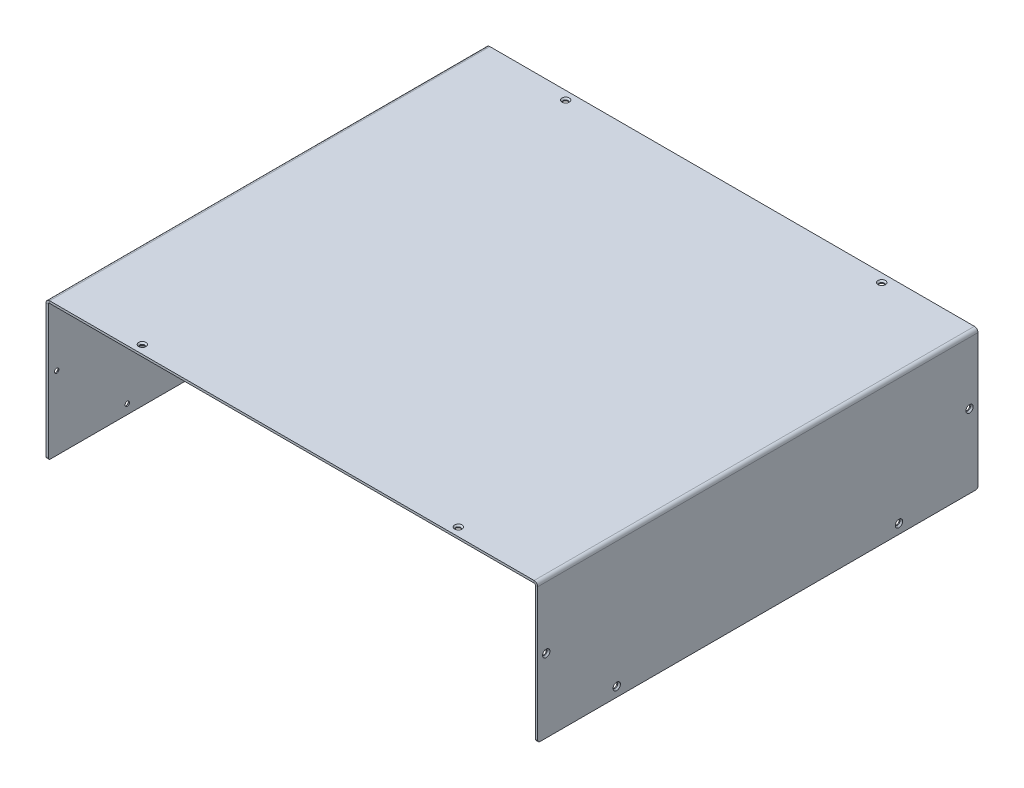
from build123d import *

# Parameters (mm, degrees)
FLANGE_BASE1_DEPTH                   = 390
ESBO_O6_R                            = 2
CORTE_EXTRUS_O1_DEPTH                = 558
ESBO_O7_R                            = 2
CORTE_EXTRUS_O2_DEPTH                = 558
QUEBRA_CANTO1_START                  = -2
QUEBRA_CANTO1_DEPTH                  = 435.6
ESCAREADO_PARA_SFHCS_M41_D           = 4
ESCAREADO_PARA_SFHCS_M41_CSINK_D     = 6.5
ESCAREADO_PARA_SFHCS_M41_CSINK_ANGLE = 90
ESCAREADO_PARA_SFHCS_M42_D           = 4
ESCAREADO_PARA_SFHCS_M42_CSINK_D     = 6.5
ESCAREADO_PARA_SFHCS_M42_CSINK_ANGLE = 90
ESCAREADO_PARA_SFHCS_M43_D           = 4
ESCAREADO_PARA_SFHCS_M43_CSINK_D     = 6.5
ESCAREADO_PARA_SFHCS_M43_CSINK_ANGLE = 90


# Read off the part's stored shape, not the designer's step: Quebra-Canto1
# Sheet-metal steps are written as plain solids
with BuildPart() as part:
    # Esboço1 → Flange-base1 (new body)
    with BuildSketch(Plane.XY):
        with BuildLine():
            Line((0, 0), (0, 119.8))
            ThreePointArc((0, 119.8), (0.351471863, 120.648528137), (1.2, 121))
            Line((1.2, 121), (430.4, 121))
            ThreePointArc((430.4, 121), (431.248528137, 120.648528137), (431.6, 119.8))
            Line((431.6, 119.8), (431.6, 0))
            Line((431.6, 0), (433.6, 0))
            Line((433.6, 0), (433.6, 119.8))
            ThreePointArc((433.6, 119.8), (432.6627417, 122.0627417), (430.4, 123))
            Line((430.4, 123), (1.2, 123))
            ThreePointArc((1.2, 123), (-1.0627417, 122.0627417), (-2, 119.8))
            Line((-2, 119.8), (-2, 0))
            Line((-2, 0), (0, 0))
        make_face()
    extrude(amount=FLANGE_BASE1_DEPTH)

    # Esboço6 → Corte-extrusão1 (cut)
    with BuildSketch(Plane(origin=(433.6, 0, 0), x_dir=(0, 0, -1), z_dir=(1, 0, 0))):
        with Locations(Location((-382.5, 65, 0), (0, 0, 180))):
            Circle(ESBO_O6_R)
        with Locations(Location((-320, 8.4, 0), (0, 0, 180))):
            Circle(ESBO_O6_R)
        with Locations(Location((-70, 8.4, 0), (0, 0, 180))):
            Circle(ESBO_O6_R)
        with Locations(Location((-7.5, 65, 0), (0, 0, 180))):
            Circle(ESBO_O6_R)
    extrude(amount=-CORTE_EXTRUS_O1_DEPTH, mode=Mode.SUBTRACT)

    # Esboço7 → Corte-extrusão2 (cut)
    with BuildSketch(Plane(origin=(0, 123, 0), x_dir=(1, 0, 0), z_dir=(0, 1, 0))):
        with Locations(Location((75.8, -7.5, 0), (0, 0, 270))):
            Circle(ESBO_O7_R)
        with Locations(Location((355.8, -7.5, 0), (0, 0, 270))):
            Circle(ESBO_O7_R)
        with Locations(Location((355.8, -382.5, 0), (0, 0, 270))):
            Circle(ESBO_O7_R)
        with Locations(Location((75.8, -382.5, 0), (0, 0, 270))):
            Circle(ESBO_O7_R)
    extrude(amount=-CORTE_EXTRUS_O2_DEPTH, mode=Mode.SUBTRACT)

    # Quebra-Canto1 outline → Quebra-Canto1 (cut)
    with BuildSketch(Plane.YZ.offset(QUEBRA_CANTO1_START)):
        with BuildLine():
            Line((0, 390), (0, 388))
            ThreePointArc((0, 388), (0.585786438, 389.414213562), (2, 390))
            Line((2, 390), (0, 390))
        make_face()
        with BuildLine():
            ThreePointArc((2, 0), (0.585786438, 0.585786438), (0, 2))
            Line((0, 2), (0, 0))
            Line((0, 0), (2, 0))
        make_face()
    extrude(amount=QUEBRA_CANTO1_DEPTH, mode=Mode.SUBTRACT)

    # Escareado para SFHCS M41 (through all)
    with Locations(Plane(origin=(0, 123, 0), x_dir=(1, 0, 0), z_dir=(0, 1, 0))):
        with Locations((75.8, -382.5), (355.8, -382.5), (355.8, -7.5), (75.8, -7.5)):
            CounterSinkHole(ESCAREADO_PARA_SFHCS_M41_D / 2, ESCAREADO_PARA_SFHCS_M41_CSINK_D / 2, counter_sink_angle=ESCAREADO_PARA_SFHCS_M41_CSINK_ANGLE)

    # Escareado para SFHCS M42 (through all)
    with Locations(Plane.ZY.offset(2)):
        with Locations((382.5, 65), (320, 8.4), (7.5, 65), (70, 8.4)):
            CounterSinkHole(ESCAREADO_PARA_SFHCS_M42_D / 2, ESCAREADO_PARA_SFHCS_M42_CSINK_D / 2, counter_sink_angle=ESCAREADO_PARA_SFHCS_M42_CSINK_ANGLE)

    # Escareado para SFHCS M43 (through all)
    with Locations(Plane(origin=(433.6, 65, 382.5), x_dir=(0, 1, 0), z_dir=(1, 0, 0))):
        with Locations((0, 0), (-56.6, -62.5), (-56.6, -312.5), (0, -375)):
            CounterSinkHole(ESCAREADO_PARA_SFHCS_M43_D / 2, ESCAREADO_PARA_SFHCS_M43_CSINK_D / 2, counter_sink_angle=ESCAREADO_PARA_SFHCS_M43_CSINK_ANGLE)


solid = part.part
